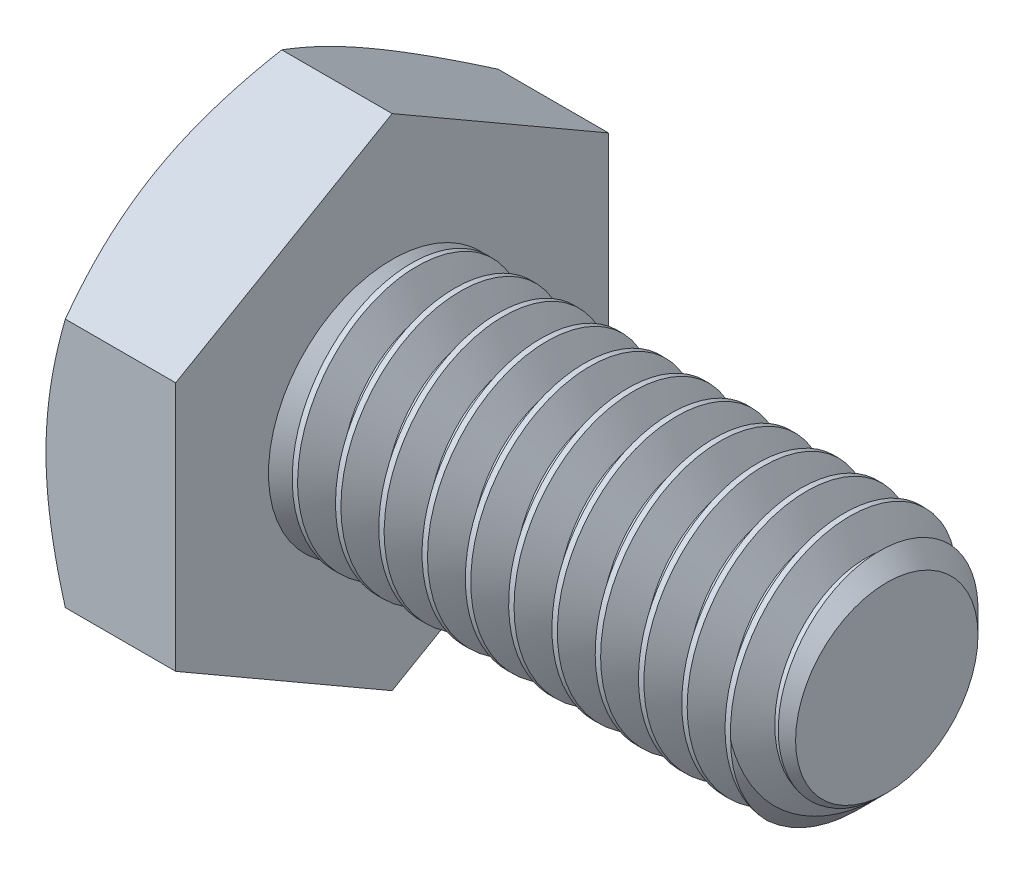
from build123d import *

# Parameters (mm, degrees)
BOSS_EXTRUDE1_START = 5.15
SKETCH2_R           = 2
BOSS_EXTRUDE1_DEPTH = 8
CHAMFER1_SIZE       = 0.525
BOSS_EXTRUDE2_START = 5.15
BOSS_EXTRUDE2_DEPTH = 2.3
SKETCH6_OUTSIDE_W   = 55.634
SKETCH6_OUTSIDE_H   = 56.716
SKETCH6_OUTSIDE_R   = 3.15
CUT_EXTRUDE1_DEPTH  = 12.604884029
CUT_EXTRUDE1_DRAFT  = -60
CUT_SWEEP1_PITCH    = 0.7


# Read off the part's stored shape, not the designer's step: Boss-Extrude3
with BuildPart() as part:
    # Sketch2 → Boss-Extrude1 (new body)
    with BuildSketch(Plane(origin=(0, 0, 0), x_dir=(0, 0, -1), z_dir=(1, 0, 0)).offset(BOSS_EXTRUDE1_START)):
        Circle(SKETCH2_R)
    extrude(amount=-BOSS_EXTRUDE1_DEPTH)

    # Chamfer1
    chamfer1_edges = [part.edges().sort_by_distance(p)[0] for p in [
        (5.15, 0, 2),
    ]]
    chamfer(chamfer1_edges, length=CHAMFER1_SIZE)

    # Cut-Sweep1: the profile of Sketch5 screwed along a right-hand helix of 12.428571 turns, 6 arcs to a turn; built about Z, then put on its axis
    cut_sweep1_z = Axis((0, 0, 0), (0, 0, 1))
    cut_sweep1_corners = [(1.545336663, 0, -0.35), (2.037888611, 0, -0.634375), (2.037888611, 0, 0.021875), (1.545336663, 0, -0.2625)]
    with BuildLine(mode=Mode.PRIVATE) as cut_sweep1_profile:
        Line(cut_sweep1_corners[0], cut_sweep1_corners[1])
        Line(cut_sweep1_corners[1], cut_sweep1_corners[2])
        Line(cut_sweep1_corners[2], cut_sweep1_corners[3])
        Line(cut_sweep1_corners[3], cut_sweep1_corners[0])
    cut_sweep1_cap = Face(cut_sweep1_profile.wire())
    cut_sweep1_turn_angles = [0, 30, 60, 90, 120, 150, 180, 210, 240, 270, 300, 330, 360]
    cut_sweep1_turn_weights = [1, 0.8660254037844387, 1, 0.8660254037844387, 1, 0.8660254037844387, 1, 0.8660254037844387, 1, 0.8660254037844387, 1, 0.8660254037844387, 1]
    cut_sweep1_turn_rails = [Edge.make_bspline([Vector(p[0], p[1], 0).rotate(cut_sweep1_z, cut_sweep1_turn_angles[k]) / cut_sweep1_turn_weights[k] + Vector(0, 0, p[2] + CUT_SWEEP1_PITCH * cut_sweep1_turn_angles[k] / 360) for k in range(13)], [0, 0, 0, 1, 1, 2, 2, 3, 3, 4, 4, 5, 5, 6, 6, 6], 2, cut_sweep1_turn_weights) for p in cut_sweep1_corners]
    cut_sweep1_turn_sides = [Face.make_surface_from_curves(cut_sweep1_turn_rails[p[0]], cut_sweep1_turn_rails[p[1]]) for p in [(0, 1), (1, 2), (2, 3), (3, 0)]]
    cut_sweep1_turn = Solid(Shell([*cut_sweep1_turn_sides, cut_sweep1_cap, cut_sweep1_cap.rotate(cut_sweep1_z, 360).moved(Location((0, 0, CUT_SWEEP1_PITCH * 360 / 360)))]))
    cut_sweep1_last_angles = [4320, 4350, 4380, 4410, 4440, 4457.142857143, 4474.285714286]
    cut_sweep1_last_weights = [1, 0.8660254037844387, 1, 0.8660254037844387, 1, 0.9555728057861561, 1]
    cut_sweep1_last_rails = [Edge.make_bspline([Vector(p[0], p[1], 0).rotate(cut_sweep1_z, cut_sweep1_last_angles[k]) / cut_sweep1_last_weights[k] + Vector(0, 0, p[2] + CUT_SWEEP1_PITCH * cut_sweep1_last_angles[k] / 360) for k in range(7)], [0, 0, 0, 1, 1, 2, 2, 3, 3, 3], 2, cut_sweep1_last_weights) for p in cut_sweep1_corners]
    cut_sweep1_last_sides = [Face.make_surface_from_curves(cut_sweep1_last_rails[p[0]], cut_sweep1_last_rails[p[1]]) for p in [(0, 1), (1, 2), (2, 3), (3, 0)]]
    cut_sweep1_last = Solid(Shell([*cut_sweep1_last_sides, cut_sweep1_cap.rotate(cut_sweep1_z, 4320).moved(Location((0, 0, CUT_SWEEP1_PITCH * 4320 / 360))), cut_sweep1_cap.rotate(cut_sweep1_z, 4474.285714286).moved(Location((0, 0, CUT_SWEEP1_PITCH * 4474.285714286 / 360)))]))
    cut_sweep1_each = [*[cut_sweep1_turn.moved(Location((0, 0, CUT_SWEEP1_PITCH * i))) for i in range(12)], cut_sweep1_last]
    add(Plane(origin=(5.15, 0, 0), x_dir=(0, 1, 0), z_dir=(-1, 0, 0)) * Compound([cut_sweep1_each[i] for i in range(0, 13, 2)]), mode=Mode.SUBTRACT)
    add(Plane(origin=(5.15, 0, 0), x_dir=(0, 1, 0), z_dir=(-1, 0, 0)) * Compound([cut_sweep1_each[i] for i in range(1, 13, 2)]), mode=Mode.SUBTRACT)



with BuildPart() as body_2:
    # Sketch3 → Boss-Extrude2 (new body)
    with BuildSketch(Plane.ZY.offset(BOSS_EXTRUDE2_START)):
        Polygon((3.5, 2.020725942), (0, 4.041451884), (-3.5, 2.020725942), (-3.5, -2.020725942), (0, -4.041451884), (3.5, -2.020725942), align=None)
    extrude(amount=-BOSS_EXTRUDE2_DEPTH)


with BuildPart() as cut_extrude1_tool:
    # Sketch6 outside → Cut-Extrude1 (with draft: the straight prism first)
    with BuildSketch(Plane.ZY.offset(5.15)):
        Rectangle(SKETCH6_OUTSIDE_W, SKETCH6_OUTSIDE_H)
        Circle(SKETCH6_OUTSIDE_R, mode=Mode.SUBTRACT)
    extrude(amount=-CUT_EXTRUDE1_DEPTH)
    # Cut-Extrude1: the draft: its side faces are tilted about the plane it starts from
    cut_extrude1_sides = [cut_extrude1_tool.faces().sort_by_distance(p)[0] for p in [
        (1.152442015, -28.358, 0),
        (1.152442015, 0, 27.817),
        (1.152442015, 28.358, 0),
        (1.152442015, 0, -27.817),
        (1.152442015, 0, -3.15),
    ]]
    draft(cut_extrude1_sides, Plane.ZY.offset(5.15), CUT_EXTRUDE1_DRAFT)


with BuildPart() as body_2_1:
    add(body_2.part)

    # Cut-Extrude1: cut by cut_extrude1_tool
    add(cut_extrude1_tool.part, mode=Mode.SUBTRACT)


with BuildPart() as part_1:
    add(part.part)

    add(body_2_1.part)  # Boss-Extrude3 merges body 2
    # Boss-Extrude3 outline → Boss-Extrude3 (revolve)
    with BuildSketch(Plane.YX):
        Polygon((2, -2.85), (1.545332213, -2.395332213), (1.545332213, -2.85), align=None)
    revolve(axis=Axis((0, 0, 0), (1, 0, 0)))


solid = part_1.part
